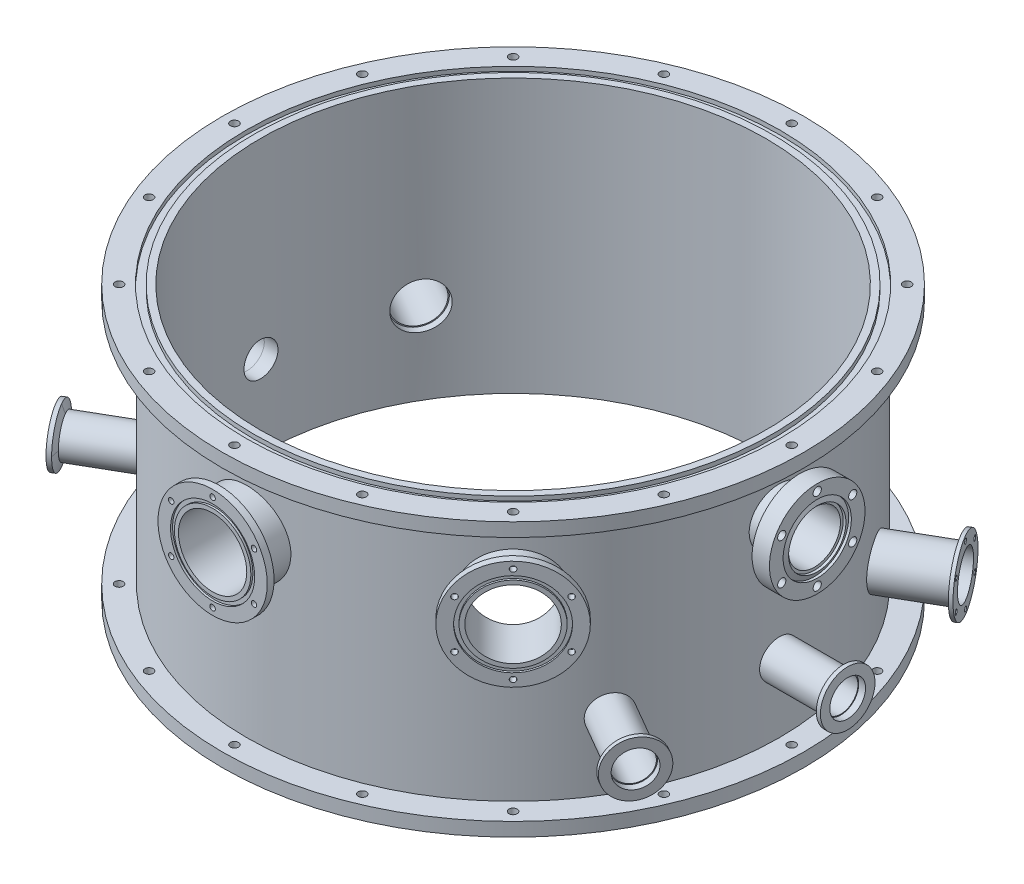
from build123d import *

# Parameters (mm, degrees)
SKETCH_1_R           = 195
SKETCH_1_R_2         = 185
EXTRUDE_1_DEPTH      = 200
SKETCH_2_R           = 213
SKETCH_2_R_2         = 3
SKETCH_2_R_3         = 195
EXTRUDE_2_DEPTH      = 10
SKETCH_5_R           = 12.45
CUT_EXTRUDE_2_DEPTH  = 300
SKETCH_6_R           = 14
SKETCH_6_R_2         = 12.5
EXTRUDE_3_DEPTH      = 50
SKETCH_7_R           = 20
SKETCH_7_R_2         = 13.1
EXTRUDE_4_DEPTH      = 5
SKETCH_9_R           = 16.75
CUT_EXTRUDE_3_DEPTH  = 300
SKETCH_10_R          = 17.5
SKETCH_10_R_2        = 16
EXTRUDE_5_DEPTH      = 50
SKETCH_11_R          = 25
SKETCH_11_R_2        = 1.75
SKETCH_11_R_3        = 16
EXTRUDE_6_DEPTH      = 2.5
SKETCH_15_R          = 12.45
CUT_EXTRUDE_4_DEPTH  = 300
SKETCH_16_R          = 14
SKETCH_16_R_2        = 12.5
EXTRUDE_7_DEPTH      = 50
SKETCH_17_R          = 20
SKETCH_17_R_2        = 13.1
EXTRUDE_8_DEPTH      = 5
SKETCH_20_R          = 16
CUT_EXTRUDE_5_DEPTH  = 300
SKETCH_21_R          = 17.5
SKETCH_21_R_2        = 16
EXTRUDE_9_DEPTH      = 50
SKETCH_22_R          = 25
SKETCH_22_R_2        = 16
EXTRUDE_10_DEPTH     = 2.5
CUT_EXTRUDE_START    = -300
SKETCH_23_R          = 12.45
CUT_EXTRUDE_6_DEPTH  = 300
EXTRUDE_START        = -50
SKETCH_24_R          = 14
SKETCH_24_R_2        = 12.5
EXTRUDE_11_DEPTH     = 50
EXTRUDE_START_2      = 5
SKETCH_25_R          = 20
SKETCH_25_R_2        = 13.1
EXTRUDE_12_DEPTH     = 5
SKETCH_27_R          = 12.45
CUT_EXTRUDE_7_DEPTH  = 300
SKETCH_28_R          = 14
SKETCH_28_R_2        = 12.5
EXTRUDE_13_DEPTH     = 50
SKETCH_29_R          = 20
SKETCH_29_R_2        = 13.1
EXTRUDE_14_DEPTH     = 5
SKETCH_32_R          = 25
CUT_EXTRUDE_8_DEPTH  = 300
SKETCH_33_R          = 30
SKETCH_33_R_2        = 25
EXTRUDE_15_DEPTH     = 25
SKETCH_34_R          = 40
SKETCH_34_R_2        = 2
SKETCH_34_R_3        = 25
EXTRUDE_16_DEPTH     = 5
SKETCH_35_R          = 30.8
SKETCH_35_R_2        = 28
CUT_EXTRUDE_9_DEPTH  = 1.5
SKETCH_36_R          = 19
CUT_EXTRUDE_10_DEPTH = 300
SKETCH_37_R          = 21
SKETCH_37_R_2        = 19
EXTRUDE_17_DEPTH     = 20
SKETCH_38_R          = 35
SKETCH_38_R_2        = 3
SKETCH_38_R_3        = 19
EXTRUDE_18_DEPTH     = 12.7
CUT_EXTRUDE_START_2  = -2
SKETCH_39_R          = 21
CUT_EXTRUDE_11_DEPTH = 2
SKETCH_41_R          = 1.75
CUT_EXTRUDE_12_DEPTH = 2
SKETCH_42_R          = 195.5
SKETCH_42_R_2        = 190
CUT_EXTRUDE_13_DEPTH = 3.1
SKETCH_44_R          = 25
CUT_EXTRUDE_14_DEPTH = 300
SKETCH_45_R          = 30
SKETCH_45_R_2        = 25
EXTRUDE_19_DEPTH     = 25
SKETCH_46_R          = 40
SKETCH_46_R_2        = 2
SKETCH_46_R_3        = 25
EXTRUDE_20_DEPTH     = 5
SKETCH_47_R          = 30.8
SKETCH_47_R_2        = 28
CUT_EXTRUDE_15_DEPTH = 1.5


with BuildPart() as part:
    # 草图1 → 凸台-拉伸1 (new body)
    with BuildSketch(Plane(origin=(0, 0, 0), x_dir=(1, 0, 0), z_dir=(0, 1, 0))):
        with Locations(Location((0, 0, 0), (0, 0, 270))):
            Circle(SKETCH_1_R)
        with Locations(Location((0, 0, 0), (0, 0, 270))):
            Circle(SKETCH_1_R_2, mode=Mode.SUBTRACT)
    extrude(amount=EXTRUDE_1_DEPTH)

    # 草图2 → 凸台-拉伸2 (add)
    with BuildSketch(Plane.XZ):
        with Locations(Location((0, 0, 0), (0, 0, 270))):
            Circle(SKETCH_2_R)
        with Locations(Location((204, 0, 0), (0, 0, 270))):
            Circle(SKETCH_2_R_2, mode=Mode.SUBTRACT)
        with Locations(Location((188.471424632, -78.067420202, 0), (0, 0, 270))):
            Circle(SKETCH_2_R_2, mode=Mode.SUBTRACT)
        with Locations(Location((144.249783362, -144.249783362, 0), (0, 0, 270))):
            Circle(SKETCH_2_R_2, mode=Mode.SUBTRACT)
        with Locations(Location((78.067420202, -188.471424632, 0), (0, 0, 270))):
            Circle(SKETCH_2_R_2, mode=Mode.SUBTRACT)
        with Locations(Location((0, -204, 0), (0, 0, 270.000000002))):
            Circle(SKETCH_2_R_2, mode=Mode.SUBTRACT)
        with Locations(Location((-78.067420202, -188.471424632, 0), (0, 0, 270))):
            Circle(SKETCH_2_R_2, mode=Mode.SUBTRACT)
        with Locations(Location((-144.249783362, -144.249783362, 0), (0, 0, 270))):
            Circle(SKETCH_2_R_2, mode=Mode.SUBTRACT)
        with Locations(Location((-188.471424632, -78.067420202, 0), (0, 0, 270))):
            Circle(SKETCH_2_R_2, mode=Mode.SUBTRACT)
        with Locations(Location((-204, 0, 0), (0, 0, 270))):
            Circle(SKETCH_2_R_2, mode=Mode.SUBTRACT)
        with Locations(Location((-188.471424632, 78.067420202, 0), (0, 0, 270))):
            Circle(SKETCH_2_R_2, mode=Mode.SUBTRACT)
        with Locations(Location((-144.249783362, 144.249783362, 0), (0, 0, 270))):
            Circle(SKETCH_2_R_2, mode=Mode.SUBTRACT)
        with Locations(Location((-78.067420202, 188.471424632, 0), (0, 0, 270))):
            Circle(SKETCH_2_R_2, mode=Mode.SUBTRACT)
        with Locations(Location((0, 204, 0), (0, 0, 270))):
            Circle(SKETCH_2_R_2, mode=Mode.SUBTRACT)
        with Locations(Location((78.067420202, 188.471424632, 0), (0, 0, 270))):
            Circle(SKETCH_2_R_2, mode=Mode.SUBTRACT)
        with Locations(Location((144.249783362, 144.249783362, 0), (0, 0, 270))):
            Circle(SKETCH_2_R_2, mode=Mode.SUBTRACT)
        with Locations(Location((188.471424632, 78.067420202, 0), (0, 0, 270))):
            Circle(SKETCH_2_R_2, mode=Mode.SUBTRACT)
        with Locations(Location((0, 0, 0), (0, 0, 270))):
            Circle(SKETCH_2_R_3, mode=Mode.SUBTRACT)
    extrude_2 = extrude(amount=-EXTRUDE_2_DEPTH)

    # 镜向1: 凸台-拉伸2 across plane
    add(extrude_2.mirror(Plane.ZX.offset(100)))

    # 草图5 → 切除-拉伸2 (cut)
    with BuildSketch(Plane(origin=(0, 0, 0), x_dir=(0, 0, -1), z_dir=(1, 0, 0))):
        with Locations(Location((0, 60, 0), (0, 0, 180))):
            Circle(SKETCH_5_R)
    extrude(amount=CUT_EXTRUDE_2_DEPTH, mode=Mode.SUBTRACT)

    # 草图6 → 凸台-拉伸3 (add)
    with BuildSketch(Plane(origin=(190, 0, 0), x_dir=(0, 0, -1), z_dir=(1, 0, 0))):
        with Locations(Location((0, 60, 0), (0, 0, 180))):
            Circle(SKETCH_6_R)
        with Locations(Location((0, 60, 0), (0, 0, 180))):
            Circle(SKETCH_6_R_2, mode=Mode.SUBTRACT)
    extrude(amount=EXTRUDE_3_DEPTH)

    # 草图7 → 凸台-拉伸4 (add)
    with BuildSketch(Plane(origin=(240, 0, 0), x_dir=(0, 0, -1), z_dir=(1, 0, 0))):
        with Locations((0, 60)):
            Circle(SKETCH_7_R)
        with Locations((0, 60)):
            Circle(SKETCH_7_R_2, mode=Mode.SUBTRACT)
    extrude(amount=EXTRUDE_4_DEPTH)

    # 草图9 → 切除-拉伸3 (cut)
    with BuildSketch(Plane(origin=(0, 0, 0), x_dir=(0.5000000000000009, 0, -0.8660254037844383), z_dir=(0.8660254037844382, 0, 0.5000000000000008))):
        with Locations((0, 60)):
            Circle(SKETCH_9_R)
    extrude(amount=-CUT_EXTRUDE_3_DEPTH, mode=Mode.SUBTRACT)

    # 草图10 → 凸台-拉伸5 (add)
    with BuildSketch(Plane(origin=(-164.544826719, 0, -95), x_dir=(0.5000000000000009, 0, -0.8660254037844383), z_dir=(0.8660254037844382, 0, 0.5000000000000008))):
        with Locations((0, 60)):
            Circle(SKETCH_10_R)
        with Locations((0, 60)):
            Circle(SKETCH_10_R_2, mode=Mode.SUBTRACT)
    extrude(amount=-EXTRUDE_5_DEPTH)

    # 草图11 → 凸台-拉伸6 (add)
    with BuildSketch(Plane(origin=(-207.846096908, 0, -120), x_dir=(-0.5000000000000009, 0, 0.8660254037844383), z_dir=(-0.8660254037844382, 0, -0.5000000000000008))):
        with Locations(Location((0, 60, 0), (0, 0, 180))):
            Circle(SKETCH_11_R)
        with Locations(Location((18.619546181, 70.75, 0), (0, 0, 180))):
            Circle(SKETCH_11_R_2, mode=Mode.SUBTRACT)
        with Locations(Location((0, 81.5, 0), (0, 0, 180))):
            Circle(SKETCH_11_R_2, mode=Mode.SUBTRACT)
        with Locations(Location((-18.619546181, 70.75, 0), (0, 0, 180))):
            Circle(SKETCH_11_R_2, mode=Mode.SUBTRACT)
        with Locations(Location((-18.619546181, 49.25, 0), (0, 0, 180))):
            Circle(SKETCH_11_R_2, mode=Mode.SUBTRACT)
        with Locations(Location((0, 38.5, 0), (0, 0, 180))):
            Circle(SKETCH_11_R_2, mode=Mode.SUBTRACT)
        with Locations(Location((18.619546181, 49.25, 0), (0, 0, 180))):
            Circle(SKETCH_11_R_2, mode=Mode.SUBTRACT)
        with Locations(Location((0, 60, 0), (0, 0, 180))):
            Circle(SKETCH_11_R_3, mode=Mode.SUBTRACT)
    extrude(amount=EXTRUDE_6_DEPTH)

    # 切除-扫描1: sweep along a curve in space
    with BuildLine() as sweep_1_path:
        ThreePointArc((240, 60, -20), (240, 74.142135624, -14.142135624), (240, 80, 0))
        ThreePointArc((240, 80, 0), (240, 74.142135624, 14.142135624), (240, 60, 20))
        ThreePointArc((240, 60, 20), (240, 45.857864376, 14.142135624), (240, 40, 0))
        ThreePointArc((240, 40, 0), (240, 45.857864376, -14.142135624), (240, 60, -20))
    # 草图13 → 切除-扫描1 (sweep, cut)
    with BuildSketch(Plane.XY):
        Polygon((242, 80), (240, 74), (240, 80), align=None)
    sweep(path=sweep_1_path.line, mode=Mode.SUBTRACT)

    # 草图15 → 切除-拉伸4 (cut)
    with BuildSketch(Plane(origin=(0, 0, 0), x_dir=(0.4999999999999952, 0, 0.8660254037844414), z_dir=(-0.8660254037844414, 0, 0.4999999999999952))):
        with Locations(Location((0, 60, 0), (0, 0, 180))):
            Circle(SKETCH_15_R)
    extrude(amount=CUT_EXTRUDE_4_DEPTH, mode=Mode.SUBTRACT)

    # 草图16 → 凸台-拉伸7 (add)
    with BuildSketch(Plane(origin=(-164.544826719, 0, 95), x_dir=(0.4999999999999952, 0, 0.8660254037844414), z_dir=(-0.8660254037844414, 0, 0.4999999999999952))):
        with Locations(Location((0, 60, 0), (0, 0, 180))):
            Circle(SKETCH_16_R)
        with Locations(Location((0, 60, 0), (0, 0, 180))):
            Circle(SKETCH_16_R_2, mode=Mode.SUBTRACT)
    extrude(amount=EXTRUDE_7_DEPTH)

    # 草图17 → 凸台-拉伸8 (add)
    with BuildSketch(Plane(origin=(-207.846096908, 0, 120), x_dir=(0.4999999999999952, 0, 0.8660254037844415), z_dir=(-0.8660254037844415, 0, 0.4999999999999953))):
        with Locations((0, 60)):
            Circle(SKETCH_17_R)
        with Locations((0, 60)):
            Circle(SKETCH_17_R_2, mode=Mode.SUBTRACT)
    extrude(amount=EXTRUDE_8_DEPTH)

    # 切除-扫描2: sweep along a curve in space
    with BuildLine() as sweep_2_path:
        ThreePointArc((-200.846096908, 60, 132.124355653), (-202.89634944, 69.899494937, 128.5732141), (-207.846096908, 74, 120))
        ThreePointArc((-207.846096908, 74, 120), (-212.795844377, 69.899494937, 111.4267859), (-214.846096908, 60, 107.875644347))
        ThreePointArc((-214.846096908, 60, 107.875644347), (-212.795844377, 50.100505063, 111.4267859), (-207.846096908, 46, 120))
        ThreePointArc((-207.846096908, 46, 120), (-202.89634944, 50.100505063, 128.5732141), (-200.846096908, 60, 132.124355653))
    # 草图19 → 切除-扫描2 (sweep, cut)
    with BuildSketch(Plane(origin=(0, 0, 0), x_dir=(0, -1, 0), z_dir=(-0.4999999999999952, 0, -0.8660254037844414))):
        Polygon((-80, 242), (-74, 240), (-80, 240), align=None)
    sweep(path=sweep_2_path.line, mode=Mode.SUBTRACT)

    # 草图20 → 切除-拉伸5 (cut)
    with BuildSketch(Plane(origin=(0, 0, 0), x_dir=(0.4999999999999952, 0, 0.8660254037844414), z_dir=(-0.8660254037844414, 0, 0.4999999999999952))):
        with Locations((0, 60)):
            Circle(SKETCH_20_R)
    extrude(amount=-CUT_EXTRUDE_5_DEPTH, mode=Mode.SUBTRACT)

    # 草图21 → 凸台-拉伸9 (add)
    with BuildSketch(Plane(origin=(164.544826719, 0, -95), x_dir=(0.4999999999999952, 0, 0.8660254037844414), z_dir=(-0.8660254037844414, 0, 0.4999999999999952))):
        with Locations((0, 60)):
            Circle(SKETCH_21_R)
        with Locations((0, 60)):
            Circle(SKETCH_21_R_2, mode=Mode.SUBTRACT)
    extrude(amount=-EXTRUDE_9_DEPTH)

    # 草图22 → 凸台-拉伸10 (add)
    with BuildSketch(Plane(origin=(207.846096908, 0, -120), x_dir=(-0.4999999999999952, 0, -0.8660254037844415), z_dir=(0.8660254037844415, 0, -0.4999999999999953))):
        with Locations((0, 60)):
            Circle(SKETCH_22_R)
        with Locations(Location((0, 60, 0), (0, 0, 180))):
            Circle(SKETCH_22_R_2, mode=Mode.SUBTRACT)
    extrude(amount=EXTRUDE_10_DEPTH)

    # 草图23 → 切除-拉伸6 (cut)
    with BuildSketch(Plane(origin=(0, 0, 0), x_dir=(0, 0, -1), z_dir=(1, 0, 0)).offset(CUT_EXTRUDE_START)):
        with Locations(Location((0, 60, 0), (0, 0, 180))):
            Circle(SKETCH_23_R)
    extrude(amount=CUT_EXTRUDE_6_DEPTH, mode=Mode.SUBTRACT)

    # 草图24 → 凸台-拉伸11 (add)
    with BuildSketch(Plane(origin=(-190, 0, 0), x_dir=(0, 0, -1), z_dir=(1, 0, 0)).offset(EXTRUDE_START)):
        with Locations(Location((0, 60, 0), (0, 0, 180))):
            Circle(SKETCH_24_R)
        with Locations(Location((0, 60, 0), (0, 0, 180))):
            Circle(SKETCH_24_R_2, mode=Mode.SUBTRACT)
    extrude(amount=EXTRUDE_11_DEPTH)

    # 草图25 → 凸台-拉伸12 (add)
    with BuildSketch(Plane.ZY.offset(240).offset(EXTRUDE_START_2)):
        with Locations(Location((0, 60, 0), (0, 0, 180))):
            Circle(SKETCH_25_R)
        with Locations(Location((0, 60, 0), (0, 0, 180))):
            Circle(SKETCH_25_R_2, mode=Mode.SUBTRACT)
    extrude(amount=-EXTRUDE_12_DEPTH)

    # 切除-扫描3: sweep along a curve in space
    with BuildLine() as sweep_3_path:
        ThreePointArc((-240, 60, 14), (-240, 69.899494937, 9.899494937), (-240, 74, 0))
        ThreePointArc((-240, 74, 0), (-240, 69.899494937, -9.899494937), (-240, 60, -14))
        ThreePointArc((-240, 60, -14), (-240, 50.100505063, -9.899494937), (-240, 46, 0))
        ThreePointArc((-240, 46, 0), (-240, 50.100505063, 9.899494937), (-240, 60, 14))
    # 草图26 → 切除-扫描3 (sweep, cut)
    with BuildSketch(Plane.XY):
        Polygon((-240, 74), (-240, 80), (-242, 80), align=None)
    sweep(path=sweep_3_path.line, mode=Mode.SUBTRACT)

    # 草图27 → 切除-拉伸7 (cut)
    with BuildSketch(Plane(origin=(0, 0, 0), x_dir=(0.5000000000000009, 0, -0.8660254037844383), z_dir=(0.8660254037844382, 0, 0.5000000000000008))):
        with Locations(Location((0, 60, 0), (0, 0, 180))):
            Circle(SKETCH_27_R)
    extrude(amount=CUT_EXTRUDE_7_DEPTH, mode=Mode.SUBTRACT)

    # 草图28 → 凸台-拉伸13 (add)
    with BuildSketch(Plane(origin=(164.544826719, 0, 95), x_dir=(0.5000000000000009, 0, -0.8660254037844383), z_dir=(0.8660254037844382, 0, 0.5000000000000008))):
        with Locations(Location((0, 60, 0), (0, 0, 180))):
            Circle(SKETCH_28_R)
        with Locations(Location((0, 60, 0), (0, 0, 180))):
            Circle(SKETCH_28_R_2, mode=Mode.SUBTRACT)
    extrude(amount=EXTRUDE_13_DEPTH)

    # 草图29 → 凸台-拉伸14 (add)
    with BuildSketch(Plane(origin=(207.846096908, 0, 120), x_dir=(0.500000000000001, 0, -0.866025403784438), z_dir=(0.866025403784438, 0, 0.500000000000001))):
        with Locations((0, 60)):
            Circle(SKETCH_29_R)
        with Locations((0, 60)):
            Circle(SKETCH_29_R_2, mode=Mode.SUBTRACT)
    extrude(amount=EXTRUDE_14_DEPTH)

    # 切除-扫描4: sweep along a curve in space
    with BuildLine() as sweep_4_path:
        ThreePointArc((214.846096908, 60, 107.875644347), (212.795844377, 69.899494937, 111.4267859), (207.846096908, 74, 120))
        ThreePointArc((207.846096908, 74, 120), (202.89634944, 69.899494937, 128.5732141), (200.846096908, 60, 132.124355653))
        ThreePointArc((200.846096908, 60, 132.124355653), (202.89634944, 50.100505063, 128.5732141), (207.846096908, 46, 120))
        ThreePointArc((207.846096908, 46, 120), (212.795844377, 50.100505063, 111.4267859), (214.846096908, 60, 107.875644347))
    # 草图31 → 切除-扫描4 (sweep, cut)
    with BuildSketch(Plane(origin=(0, 0, 0), x_dir=(0, -1, 0), z_dir=(-0.5000000000000007, 0, 0.8660254037844383))):
        Polygon((-74, 240), (-80, 240), (-80, 242), align=None)
    sweep(path=sweep_4_path.line, mode=Mode.SUBTRACT)

    # 草图32 → 切除-拉伸8 (cut)
    with BuildSketch(Plane.XY):
        with Locations(Location((0, 140, 0), (0, 0, 180))):
            Circle(SKETCH_32_R)
    extrude(amount=CUT_EXTRUDE_8_DEPTH, mode=Mode.SUBTRACT)

    # 草图33 → 凸台-拉伸15 (add)
    with BuildSketch(Plane.XY.offset(190)):
        with Locations(Location((0, 140, 0), (0, 0, 180))):
            Circle(SKETCH_33_R)
        with Locations(Location((0, 140, 0), (0, 0, 180))):
            Circle(SKETCH_33_R_2, mode=Mode.SUBTRACT)
    extrude(amount=EXTRUDE_15_DEPTH)

    # 草图34 → 凸台-拉伸16 (add)
    with BuildSketch(Plane.XY.offset(215)):
        with Locations((0, 140)):
            Circle(SKETCH_34_R)
        with Locations((30.310889132, 157.5)):
            Circle(SKETCH_34_R_2, mode=Mode.SUBTRACT)
        with Locations((0, 175)):
            Circle(SKETCH_34_R_2, mode=Mode.SUBTRACT)
        with Locations((-30.310889132, 157.5)):
            Circle(SKETCH_34_R_2, mode=Mode.SUBTRACT)
        with Locations((-30.310889132, 122.5)):
            Circle(SKETCH_34_R_2, mode=Mode.SUBTRACT)
        with Locations((0, 105)):
            Circle(SKETCH_34_R_2, mode=Mode.SUBTRACT)
        with Locations((30.310889132, 122.5)):
            Circle(SKETCH_34_R_2, mode=Mode.SUBTRACT)
        with Locations(Location((0, 140, 0), (0, 0, 180))):
            Circle(SKETCH_34_R_3, mode=Mode.SUBTRACT)
    extrude(amount=EXTRUDE_16_DEPTH)

    # 草图35 → 切除-拉伸9 (cut)
    with BuildSketch(Plane.XY.offset(220)):
        with Locations((0, 140)):
            Circle(SKETCH_35_R)
        with Locations((0, 140)):
            Circle(SKETCH_35_R_2, mode=Mode.SUBTRACT)
    extrude(amount=-CUT_EXTRUDE_9_DEPTH, mode=Mode.SUBTRACT)

    # 草图36 → 切除-拉伸10 (cut)
    with BuildSketch(Plane(origin=(0, 0, 0), x_dir=(0, 0, -1), z_dir=(1, 0, 0))):
        with Locations(Location((0, 150, 0), (0, 0, 180))):
            Circle(SKETCH_36_R)
    extrude(amount=CUT_EXTRUDE_10_DEPTH, mode=Mode.SUBTRACT)

    # 草图37 → 凸台-拉伸17 (add)
    with BuildSketch(Plane(origin=(190, 0, 0), x_dir=(0, 0, -1), z_dir=(1, 0, 0))):
        with Locations(Location((0, 150, 0), (0, 0, 180))):
            Circle(SKETCH_37_R)
        with Locations(Location((0, 150, 0), (0, 0, 180))):
            Circle(SKETCH_37_R_2, mode=Mode.SUBTRACT)
    extrude(amount=EXTRUDE_17_DEPTH)

    # 草图38 → 凸台-拉伸18 (add)
    with BuildSketch(Plane(origin=(210, 0, 0), x_dir=(0, 0, -1), z_dir=(1, 0, 0))):
        with Locations((0, 150)):
            Circle(SKETCH_38_R)
        with Locations((25.980762114, 135)):
            Circle(SKETCH_38_R_2, mode=Mode.SUBTRACT)
        with Locations((0, 120)):
            Circle(SKETCH_38_R_2, mode=Mode.SUBTRACT)
        with Locations((-25.980762114, 135)):
            Circle(SKETCH_38_R_2, mode=Mode.SUBTRACT)
        with Locations((-25.980762114, 165)):
            Circle(SKETCH_38_R_2, mode=Mode.SUBTRACT)
        with Locations((0, 180)):
            Circle(SKETCH_38_R_2, mode=Mode.SUBTRACT)
        with Locations((25.980762114, 165)):
            Circle(SKETCH_38_R_2, mode=Mode.SUBTRACT)
        with Locations(Location((0, 150, 0), (0, 0, 180))):
            Circle(SKETCH_38_R_3, mode=Mode.SUBTRACT)
    extrude(amount=EXTRUDE_18_DEPTH)

    # 草图39 → 切除-拉伸11 (cut)
    with BuildSketch(Plane(origin=(222.7, 0, 0), x_dir=(0, 0, -1), z_dir=(1, 0, 0)).offset(CUT_EXTRUDE_START_2)):
        with Locations(Location((0, 150, 0), (0, 0, 180))):
            Circle(SKETCH_39_R)
    extrude(amount=CUT_EXTRUDE_11_DEPTH, mode=Mode.SUBTRACT)

    # 草图40 → 切除-旋转1 (revolve, cut)
    with BuildSketch(Plane.XY, mode=Mode.PRIVATE) as cut_revolve_1_sk:
        Polygon((222.7, 125), (220.7, 125), (222.7, 129), align=None)
    revolve(cut_revolve_1_sk.sketch.rotate(Axis((222.7, 150, 0), (-1, 0, 0)), 270), axis=Axis((222.7, 150, 0), (-1, 0, 0)), mode=Mode.SUBTRACT)

    # 草图41 → 切除-拉伸12 (cut)
    with BuildSketch(Plane(origin=(210.011160418, 0, -121.25), x_dir=(-0.4999999999999954, 0, -0.8660254037844414), z_dir=(0.8660254037844413, 0, -0.49999999999999534))):
        with Locations((0, 81.5)):
            Circle(SKETCH_41_R)
        with Locations((18.619546181, 70.75)):
            Circle(SKETCH_41_R)
        with Locations((18.619546181, 49.25)):
            Circle(SKETCH_41_R)
        with Locations((0, 38.5)):
            Circle(SKETCH_41_R)
        with Locations((-18.619546181, 49.25)):
            Circle(SKETCH_41_R)
        with Locations((-18.619546181, 70.75)):
            Circle(SKETCH_41_R)
    extrude(amount=-CUT_EXTRUDE_12_DEPTH, mode=Mode.SUBTRACT)

    # 草图42 → 切除-拉伸13 (cut)
    with BuildSketch(Plane.XZ):
        with Locations(Location((0, 0, 0), (0, 0, 270))):
            Circle(SKETCH_42_R)
        with Locations(Location((0, 0, 0), (0, 0, 270))):
            Circle(SKETCH_42_R_2, mode=Mode.SUBTRACT)
    cut_extrude_13 = extrude(amount=-CUT_EXTRUDE_13_DEPTH, mode=Mode.SUBTRACT)

    # 镜向3: 切除-拉伸13 across plane
    add(cut_extrude_13.mirror(Plane.ZX.offset(100)), mode=Mode.SUBTRACT)

    # 草图44 → 切除-拉伸14 (cut)
    with BuildSketch(Plane(origin=(0, 0, 0), x_dir=(-0.7071067811865435, 0, 0.7071067811865517), z_dir=(-0.7071067811865517, 0, -0.7071067811865435))):
        with Locations((0, 140)):
            Circle(SKETCH_44_R)
    extrude(amount=-CUT_EXTRUDE_14_DEPTH, mode=Mode.SUBTRACT)

    # 草图45 → 凸台-拉伸19 (add)
    with BuildSketch(Plane(origin=(134.350288425, 0, 134.350288425), x_dir=(-0.7071067811865435, 0, 0.7071067811865517), z_dir=(-0.7071067811865517, 0, -0.7071067811865435))):
        with Locations((0, 140)):
            Circle(SKETCH_45_R)
        with Locations((0, 140)):
            Circle(SKETCH_45_R_2, mode=Mode.SUBTRACT)
    extrude(amount=-EXTRUDE_19_DEPTH)

    # 草图46 → 凸台-拉伸20 (add)
    with BuildSketch(Plane(origin=(152.027957955, 0, 152.027957955), x_dir=(0.7071067811865437, 0, -0.7071067811865515), z_dir=(0.7071067811865515, 0, 0.7071067811865437))):
        with Locations((0, 140)):
            Circle(SKETCH_46_R)
        with Locations((30.310889132, 122.5)):
            Circle(SKETCH_46_R_2, mode=Mode.SUBTRACT)
        with Locations((0, 105)):
            Circle(SKETCH_46_R_2, mode=Mode.SUBTRACT)
        with Locations((-30.310889132, 122.5)):
            Circle(SKETCH_46_R_2, mode=Mode.SUBTRACT)
        with Locations((-30.310889132, 157.5)):
            Circle(SKETCH_46_R_2, mode=Mode.SUBTRACT)
        with Locations((0, 175)):
            Circle(SKETCH_46_R_2, mode=Mode.SUBTRACT)
        with Locations((30.310889132, 157.5)):
            Circle(SKETCH_46_R_2, mode=Mode.SUBTRACT)
        with Locations(Location((0, 140, 0), (0, 0, 180))):
            Circle(SKETCH_46_R_3, mode=Mode.SUBTRACT)
    extrude(amount=EXTRUDE_20_DEPTH)

    # 草图47 → 切除-拉伸15 (cut)
    with BuildSketch(Plane(origin=(155.563491861, 0, 155.563491861), x_dir=(0.7071067811865437, 0, -0.7071067811865515), z_dir=(0.7071067811865515, 0, 0.7071067811865437))):
        with Locations((0, 140)):
            Circle(SKETCH_47_R)
        with Locations((0, 140)):
            Circle(SKETCH_47_R_2, mode=Mode.SUBTRACT)
    extrude(amount=-CUT_EXTRUDE_15_DEPTH, mode=Mode.SUBTRACT)


solid = part.part
